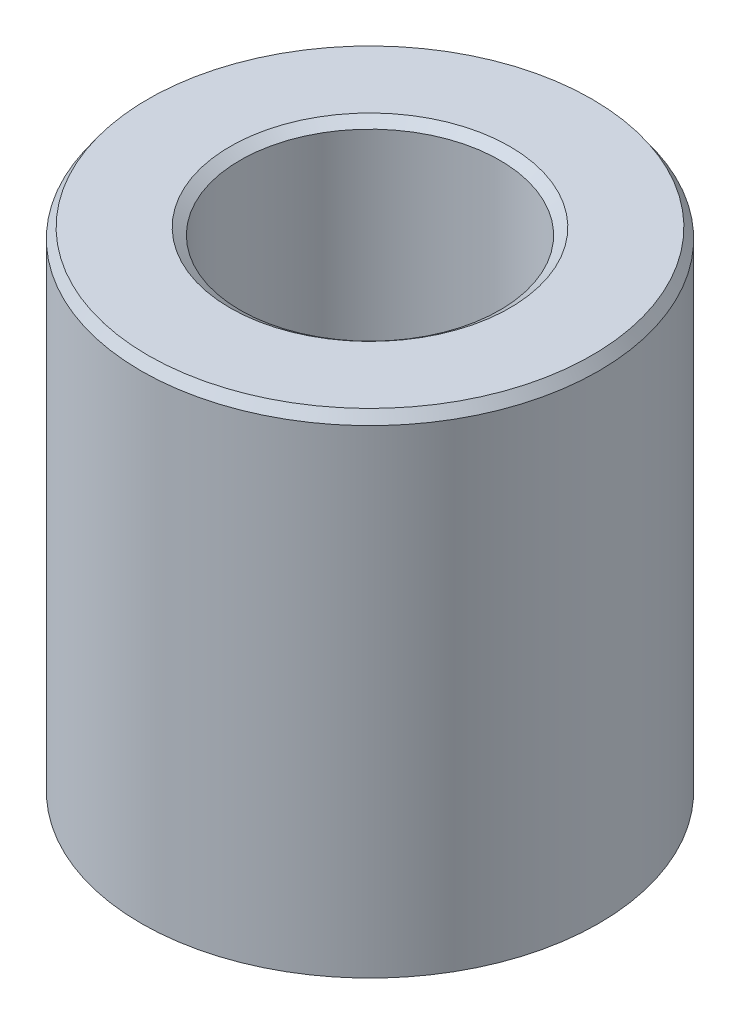
from build123d import *
from OCP.BRepFilletAPI import BRepFilletAPI_MakeChamfer

# Parameters (mm, degrees)
SKETCH1_R           = 60
BOSS_EXTRUDE1_DEPTH = 129.861566175
SKETCH2_R           = 34.043735332
CUT_EXTRUDE1_DEPTH  = 156.125840431
CHAMFER1_SIZE       = 2.628508882
CHAMFER1_SIZE2      = 1.811175952


with BuildPart() as part:
    # Sketch1 → Boss-Extrude1 (new body)
    with BuildSketch(Plane(origin=(0, 0, 0), x_dir=(1, 0, 0), z_dir=(0, 1, 0))):
        Circle(SKETCH1_R)
    extrude(amount=BOSS_EXTRUDE1_DEPTH)

    # Sketch2 → Cut-Extrude1 (cut, through all)
    with BuildSketch(Plane(origin=(0, 0, 0), x_dir=(1, 0, 0), z_dir=(0, 1, 0))):
        Circle(SKETCH2_R)
    extrude(amount=CUT_EXTRUDE1_DEPTH, mode=Mode.SUBTRACT)

    # Chamfer1: one chamfer whose edges measure the first distance from different faces: ONE call of the kernel's chamfer builder (chamfer() names one face for all edges)
    chamfer1_edges_1 = [part.edges().sort_by_distance(p)[0] for p in [
        (-34.043735332, 129.861566175, 0),
    ]]
    chamfer1_side_1 = [part.faces().sort_by_distance(p)[0] for p in [
        (-58.302943725, 129.861566175, 0),
    ]]
    chamfer1_edges_2 = [part.edges().sort_by_distance(p)[0] for p in [
        (-34.043735332, 0, 0),
    ]]
    chamfer1_side_2 = [part.faces().sort_by_distance(p)[0] for p in [
        (-34.043735332, 64.930783088, 0),
    ]]
    chamfer1_edges_3 = [part.edges().sort_by_distance(p)[0] for p in [
        (-60, 0, 0),
    ]]
    chamfer1_side_3 = [part.faces().sort_by_distance(p)[0] for p in [
        (-58.302943725, 0, 0),
    ]]
    chamfer1_edges_4 = [part.edges().sort_by_distance(p)[0] for p in [
        (-60, 129.861566175, 0),
    ]]
    chamfer1_side_4 = [part.faces().sort_by_distance(p)[0] for p in [
        (-60, 64.930783088, 0),
    ]]
    chamfer1 = BRepFilletAPI_MakeChamfer(part.part.solid().wrapped)
    for e in chamfer1_edges_1:
        chamfer1.Add(CHAMFER1_SIZE, CHAMFER1_SIZE2, e.wrapped, chamfer1_side_1[0].wrapped)  # the first distance lies on this face
    for e in chamfer1_edges_2:
        chamfer1.Add(CHAMFER1_SIZE, CHAMFER1_SIZE2, e.wrapped, chamfer1_side_2[0].wrapped)  # the first distance lies on this face
    for e in chamfer1_edges_3:
        chamfer1.Add(CHAMFER1_SIZE, CHAMFER1_SIZE2, e.wrapped, chamfer1_side_3[0].wrapped)  # the first distance lies on this face
    for e in chamfer1_edges_4:
        chamfer1.Add(CHAMFER1_SIZE, CHAMFER1_SIZE2, e.wrapped, chamfer1_side_4[0].wrapped)  # the first distance lies on this face
    add(Compound.cast(chamfer1.Shape()), mode=Mode.REPLACE)


solid = part.part
